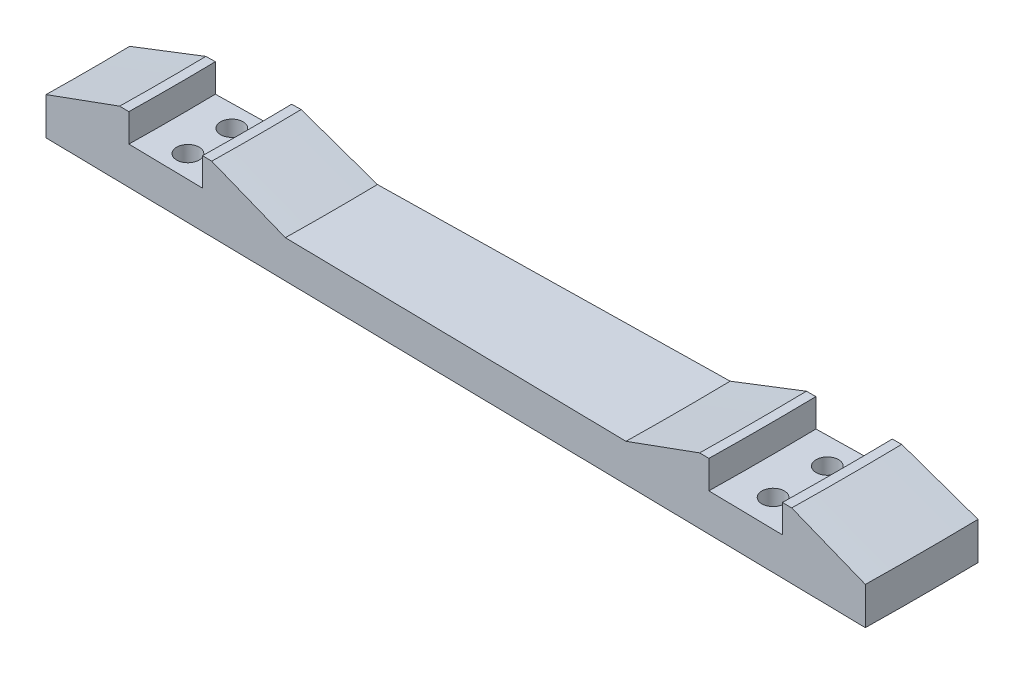
from build123d import *

# Parameters (mm, degrees)
EXTRUDE_1_DEPTH     = 2.5
SKETCH_5_R          = 0.6
CUT_EXTRUDE_1_DEPTH = 19.036421485
CUT_EXTRUDE_START   = -2
SKETCH_5_3_R        = 1
CUT_EXTRUDE_2_DEPTH = 1
REVOLVE_1_ANGLE     = 1
SKETCH_9_R          = 0.6
CUT_EXTRUDE_3_DEPTH = 41.426698916
SKETCH_9_3_R        = 1
CUT_EXTRUDE_4_DEPTH = 1
SKETCH_10_W         = 44.5
SKETCH_10_H         = 2.5
CUT_EXTRUDE_5_DEPTH = 41.528606999


with BuildPart() as part:
    # 草图4 → 凸台-拉伸1 (new body)
    with BuildSketch(Plane.XY):
        Polygon((8.5, -1.5), (17.75, -1.5), (17.75, -3.5), (-4.5, -3.5), (-4.5, -1.5), (-0.5, 0), (0, 0), (0, -1.5), (4, -1.5), (4, 0), (4.5, 0), align=None)
    extrude(amount=EXTRUDE_1_DEPTH)

    # 草图5 → 切除-拉伸1 (cut, through all)
    with BuildSketch(Plane(origin=(0, -1.5, 0), x_dir=(1, 0, 0), z_dir=(0, 1, 0))):
        with Locations(Location((2, -1.25, 0), (0, 0, 270))):
            Circle(SKETCH_5_R)
    extrude(amount=-CUT_EXTRUDE_1_DEPTH, mode=Mode.SUBTRACT)

    # 草图5<3> → 切除-拉伸2 (cut)
    with BuildSketch(Plane(origin=(0, -1.5, 0), x_dir=(1, 0, 0), z_dir=(0, 1, 0)).offset(CUT_EXTRUDE_START)):
        with Locations((2, -1.25)):
            Circle(SKETCH_5_3_R)
    extrude(amount=CUT_EXTRUDE_2_DEPTH, mode=Mode.SUBTRACT)

    # 镜向1: part across plane


with BuildPart() as part_1:
    add(part.part)
    add(part.part.mirror(Plane(origin=(17.75, 0, 2.5), x_dir=(0, 0, 1), z_dir=(1, 0, 0))))

    # 草图6 → 旋转1 (revolve)
    with BuildSketch(Plane.XY.offset(2.5)):
        Polygon((0, 0), (-0.5, 0), (-4.5, -1.5), (-4.5, -3.5), (40, -3.5), (40, -1.5), (36, 0), (35.5, 0), (35.5, -1.5), (31.5, -1.5), (31.5, 0), (31, 0), (27, -1.5), (8.5, -1.5), (4.5, 0), (4, 0), (4, -1.5), (0, -1.5), align=None)
    revolve(axis=Axis((-132.25, 94.8535776, 2.5), (0, -1, 0)), revolution_arc=REVOLVE_1_ANGLE)

    # 草图9 → 切除-拉伸3 (cut, through all)
    with BuildSketch(Plane(origin=(0, -1.5, 0), x_dir=(1, 0, 0), z_dir=(0, 1, 0))):
        with Locations(Location((1.994888171, -3.671537391, 0), (0, 0, 180))):
            Circle(SKETCH_9_R)
        with Locations(Location((33.493688748, -3.946423259, 0), (0, 0, 180))):
            Circle(SKETCH_9_R)
    extrude(amount=-CUT_EXTRUDE_3_DEPTH, mode=Mode.SUBTRACT)

    # 草图9<3> → 切除-拉伸4 (cut)
    with BuildSketch(Plane(origin=(0, -1.5, 0), x_dir=(1, 0, 0), z_dir=(0, 1, 0)).offset(CUT_EXTRUDE_START)):
        with Locations((1.994888171, -3.671537391)):
            Circle(SKETCH_9_3_R)
        with Locations((33.493688748, -3.946423259)):
            Circle(SKETCH_9_3_R)
    extrude(amount=CUT_EXTRUDE_4_DEPTH, mode=Mode.SUBTRACT)

    # 草图10 → 切除-拉伸5 (cut, through all)
    with BuildSketch(Plane(origin=(0, 0, 0), x_dir=(1, 0, 0), z_dir=(0, 1, 0))):
        with Locations((17.75, -1.25)):
            Rectangle(SKETCH_10_W, SKETCH_10_H)
    extrude(amount=-CUT_EXTRUDE_5_DEPTH, mode=Mode.SUBTRACT)

    # 镜向2: part across plane


with BuildPart() as part_2:
    add(part_1.part)
    add(part_1.part.mirror(Plane(origin=(40, -3.5, 2.5), x_dir=(1, 0, 0), z_dir=(0, 0, 1))))


solid = part_2.part
